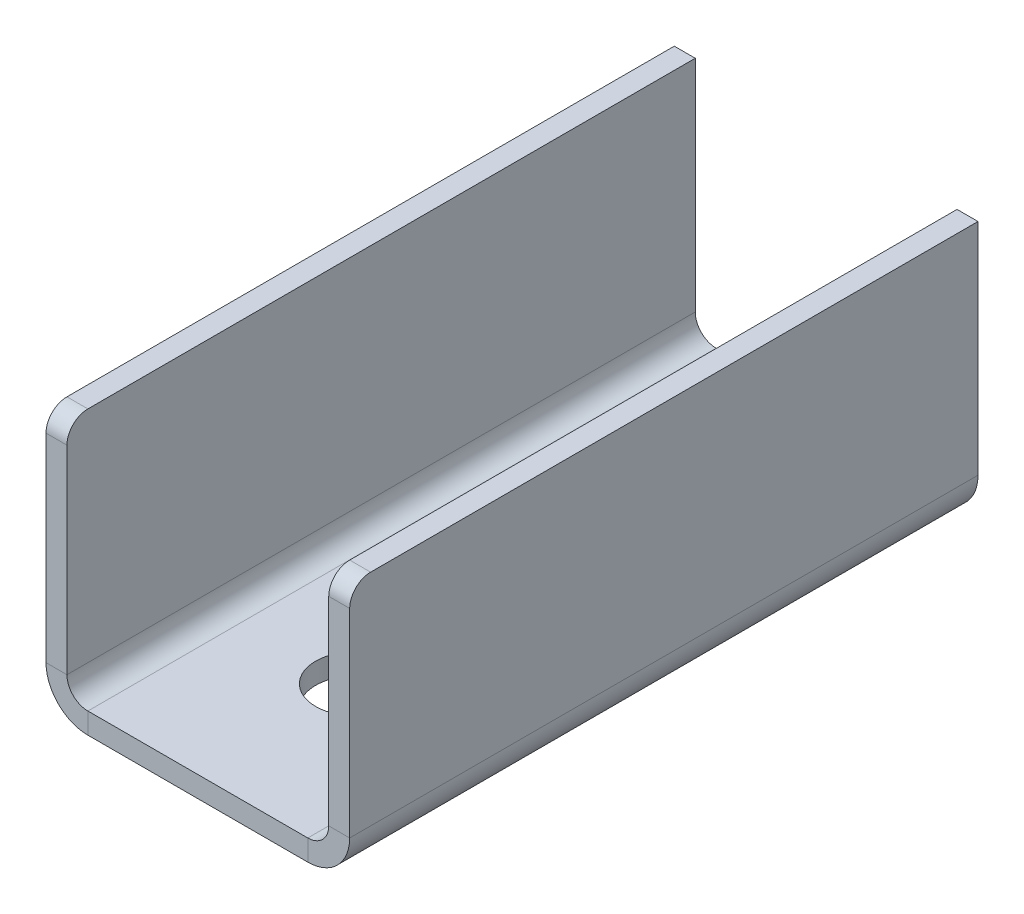
from build123d import *

# Parameters (mm, degrees)
EXTRUDE_1_DEPTH       = 60
SHEET_METAL_1_DEPTH   = 60
SHEET_METAL_1_2_DEPTH = 60
CUT_EXTRUDE_1_REACH   = 68.591
SKETCH_2_R            = 3.75
FILLET_1_R            = 2


# Read off the part's stored shape, not the designer's step: Преобразовать-Твердое тело1
with BuildPart() as part:
    # Sketch 1 → Бобышка-Вытянуть1 (new body)
    with BuildSketch(Plane.XY):
        Polygon((-12.5, 2), (12.5, 2), (12.5, 24.983479724), (14.5, 24.983479724), (14.5, 0), (-14.5, 0), (-14.5, 24.983479724), (-12.5, 24.983479724), align=None)
    extrude(amount=EXTRUDE_1_DEPTH)

    # Sheet Metal 1 outline → Sheet Metal 1 (cut)
    with BuildSketch(Plane.XY):
        with BuildLine():
            Line((-14.5, 0), (-10.5, 0))
            ThreePointArc((-10.5, 0), (-13.328427125, 1.171572875), (-14.5, 4))
            Line((-14.5, 4), (-14.5, 0))
        make_face()
        with BuildLine():
            ThreePointArc((14.5, 4), (13.328427125, 1.171572875), (10.5, 0))
            Line((10.5, 0), (14.5, 0))
            Line((14.5, 0), (14.5, 4))
        make_face()
    extrude(amount=SHEET_METAL_1_DEPTH, mode=Mode.SUBTRACT)

    # Sheet Metal 1 2 outline → Sheet Metal 1 2 (add)
    with BuildSketch(Plane.XY):
        with BuildLine():
            Line((-12.5, 2), (-10.5, 2))
            ThreePointArc((-10.5, 2), (-11.914213562, 2.585786438), (-12.5, 4))
            Line((-12.5, 4), (-12.5, 2))
        make_face()
        with BuildLine():
            ThreePointArc((12.5, 4), (11.914213562, 2.585786438), (10.5, 2))
            Line((10.5, 2), (12.5, 2))
            Line((12.5, 2), (12.5, 4))
        make_face()
    extrude(amount=SHEET_METAL_1_2_DEPTH)

    # Sketch 2 → Вырез-Вытянуть1 (cut, up to next)
    with BuildSketch(Plane.XZ, mode=Mode.PRIVATE) as cut_extrude_1_sk1:
        with Locations(Location((0, 45, 0), (0, 0, 270))):
            Circle(SKETCH_2_R)
    cut_extrude_1_tool1 = extrude(cut_extrude_1_sk1.sketch, amount=-CUT_EXTRUDE_1_REACH, mode=Mode.PRIVATE) & part.part
    # Sketch 2 → Вырез-Вытянуть1 (cut, up to next)
    with BuildSketch(Plane.XZ, mode=Mode.PRIVATE) as cut_extrude_1_sk2:
        with Locations(Location((0, 15, 0), (0, 0, 270))):
            Circle(SKETCH_2_R)
    cut_extrude_1_tool2 = extrude(cut_extrude_1_sk2.sketch, amount=-CUT_EXTRUDE_1_REACH, mode=Mode.PRIVATE) & part.part
    add(cut_extrude_1_tool1.solids().sort_by_distance((0, 0, 45))[0], mode=Mode.SUBTRACT)
    add(cut_extrude_1_tool2.solids().sort_by_distance((0, 0, 15))[0], mode=Mode.SUBTRACT)

    # Скругление1
    fillet_1_edges = [part.edges().sort_by_distance(p)[0] for p in [
        (13.5, 24.983479724, 60),
        (-13.5, 24.983479724, 60),
    ]]
    fillet(fillet_1_edges, radius=FILLET_1_R)


solid = part.part
